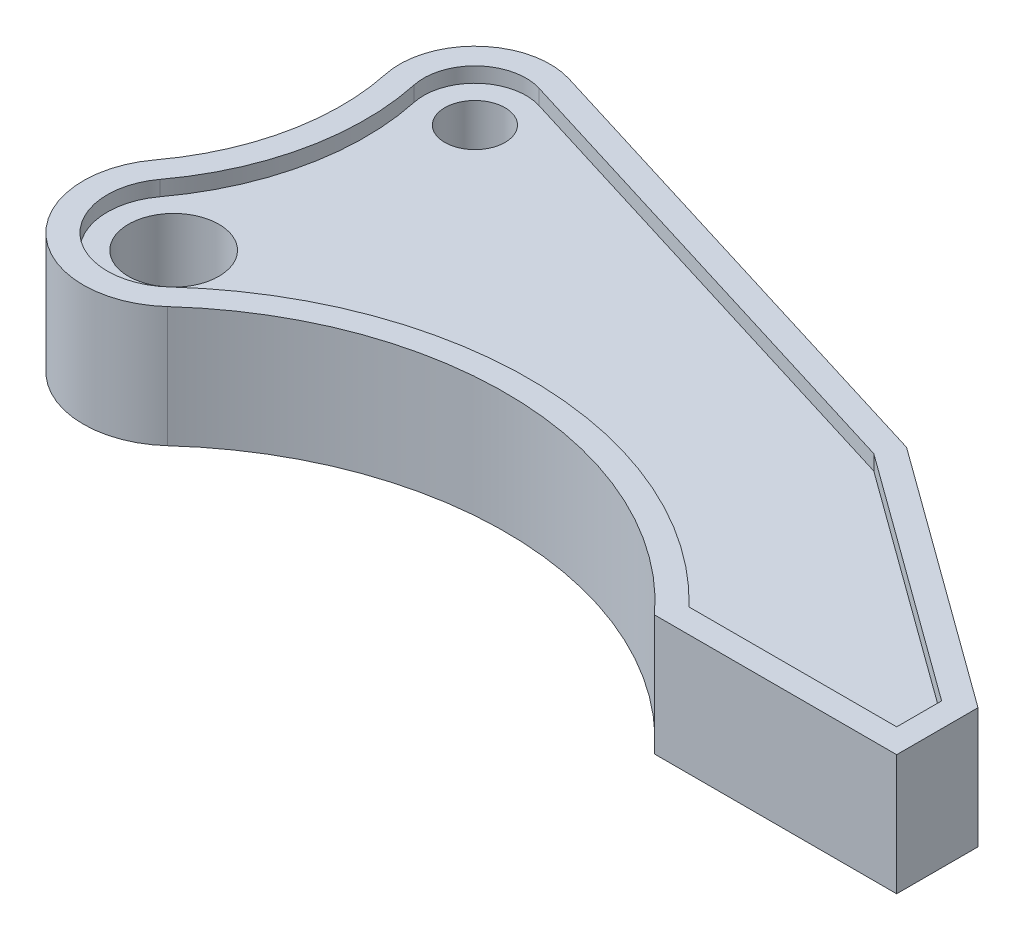
from build123d import *
from build123d.topology import SkipClean

# Parameters (mm, degrees)
BOSS_EXTRUDE1_DEPTH = 15
BOSS_EXTRUDE2_DEPTH = 20
SKETCH5_R           = 15
SKETCH5_R_2         = 10
CUT_EXTRUDE1_DEPTH  = 30


with BuildPart() as part:
    # Sketch1 → Boss-Extrude1 (new, symmetric)
    with BuildSketch(Plane(origin=(0, 0, 0), x_dir=(1, 0, 0), z_dir=(0, 1, 0))):
        with BuildLine():
            Line((21.361321264, 109.891650199), (183.28793901, 60))
            Line((183.28793901, 60), (270, -3))
            Line((270, -3), (270, -30))
            Line((270, -30), (189.628727834, -30))
            ThreePointArc((189.628727834, -30), (106.532601106, 8.971535214), (20.2, -22.180171325))
            ThreePointArc((20.2, -22.180171325), (-20.126889413, -22.246535068), (-24.085330203, 17.885660989))
            ThreePointArc((-24.085330203, 17.885660989), (-10.481072196, 47.848151082), (-10.44349241, 80.754461058))
            ThreePointArc((-10.44349241, 80.754461058), (-2.887690503, 104.433825145), (21.361321264, 109.891650199))
        make_face()
    extrude(amount=BOSS_EXTRUDE1_DEPTH, both=True)

    # Sketch2 → Boss-Extrude2 (add, symmetric)
    with SkipClean():  # the faces are left unmerged after this step: merging them gives an invalid solid
        with BuildSketch(Plane(origin=(0, 0, 0), x_dir=(1, 0, 0), z_dir=(0, 1, 0))):
            with BuildLine():
                Line((189.628727834, -30), (270, -30))
                Line((270, -30), (270, -3))
                Line((270, -3), (183.28793901, 60))
                Line((183.28793901, 60), (21.361321264, 109.891650199))
                ThreePointArc((21.361321264, 109.891650199), (-2.887690503, 104.433825145), (-10.44349241, 80.754461058))
                ThreePointArc((-10.44349241, 80.754461058), (-10.481072196, 47.848151082), (-24.085330203, 17.885660989))
                ThreePointArc((-24.085330203, 17.885660989), (-20.126889413, -22.246535068), (20.2, -22.180171325))
                ThreePointArc((20.2, -22.180171325), (106.532601106, 8.971535214), (189.628727834, -30))
            make_face()
            with BuildLine():
                Line((193.090377844, -22), (262, -22))
                Line((262, -22), (262, -7.076203596))
                Line((262, -7.076203596), (179.661480345, 52.746232627))
                Line((179.661480345, 52.746232627), (19.00569846, 102.246322136))
                ThreePointArc((19.00569846, 102.246322136), (2.516370458, 98.535001099), (-2.621574839, 82.43303352))
                ThreePointArc((-2.621574839, 82.43303352), (-2.663008962, 46.151717392), (-17.662575482, 13.116151392))
                ThreePointArc((-17.662575482, 13.116151392), (-14.759718903, -16.314125717), (14.813333333, -16.265458972))
                ThreePointArc((14.813333333, -16.265458972), (105.1151782, 17.032975134), (193.090377844, -22))
            make_face(mode=Mode.SUBTRACT)
        extrude(amount=BOSS_EXTRUDE2_DEPTH, both=True)
    add(part.part.scale(1), mode=Mode.REPLACE)  # the faces are merged on a copy

    # Sketch5 → Cut-Extrude1 (cut)
    with BuildSketch(Plane(origin=(0, 15, 0), x_dir=(1, 0, 0), z_dir=(0, 1, 0))):
        Circle(SKETCH5_R)
        with Locations((14, 86)):
            Circle(SKETCH5_R_2)
    extrude(amount=-CUT_EXTRUDE1_DEPTH, mode=Mode.SUBTRACT)


solid = part.part
